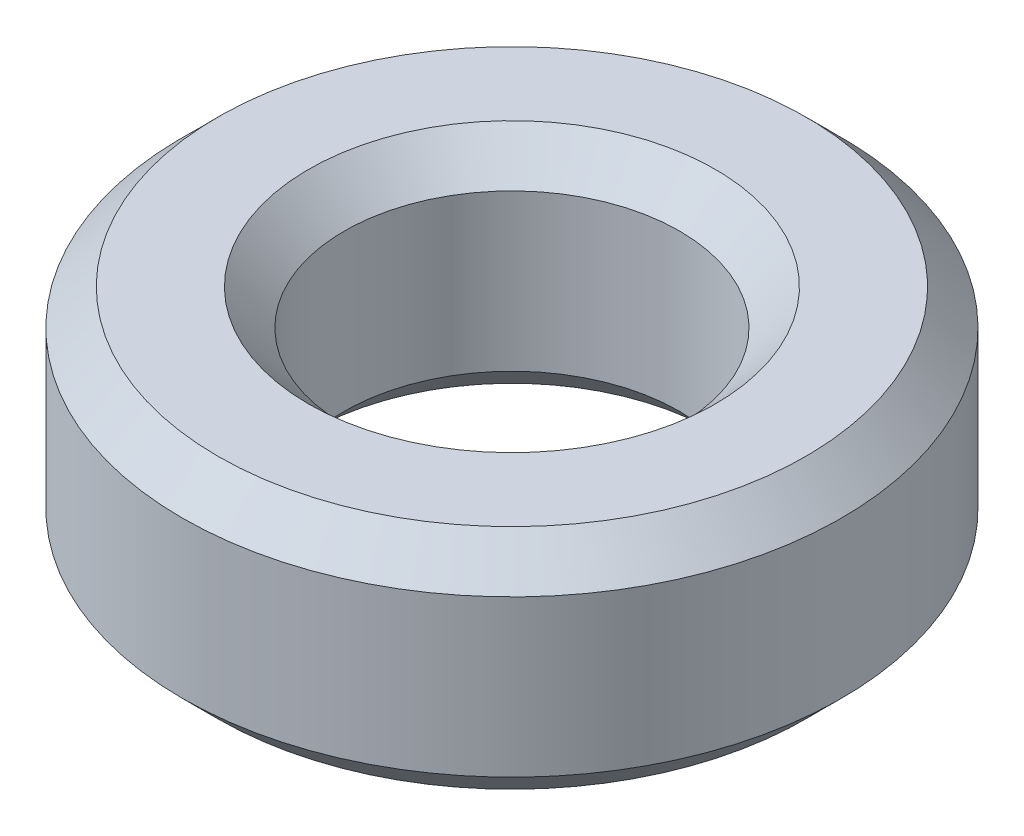
from build123d import *

# Parameters (mm, degrees)
SKETCH1_R           = 20
BOSS_EXTRUDE1_DEPTH = 13.801729277
SKETCH2_R           = 10.175138079
CUT_EXTRUDE1_DEPTH  = 32.472015046
CHAMFER1_SIZE       = 2.163027552


with BuildPart() as part:
    # Sketch1 → Boss-Extrude1 (new body)
    with BuildSketch(Plane(origin=(0, 0, 0), x_dir=(1, 0, 0), z_dir=(0, 1, 0))):
        Circle(SKETCH1_R)
    extrude(amount=BOSS_EXTRUDE1_DEPTH)

    # Sketch2 → Cut-Extrude1 (cut, through all)
    with BuildSketch(Plane(origin=(0, 0, 0), x_dir=(1, 0, 0), z_dir=(0, 1, 0))):
        Circle(SKETCH2_R)
    extrude(amount=CUT_EXTRUDE1_DEPTH, mode=Mode.SUBTRACT)

    # Chamfer1
    chamfer1_edges = [part.edges().sort_by_distance(p)[0] for p in [
        (-10.175138079, 13.801729277, 0),
        (-10.175138079, 0, 0),
        (-20, 0, 0),
        (-20, 13.801729277, 0),
    ]]
    chamfer(chamfer1_edges, length=CHAMFER1_SIZE)


solid = part.part
